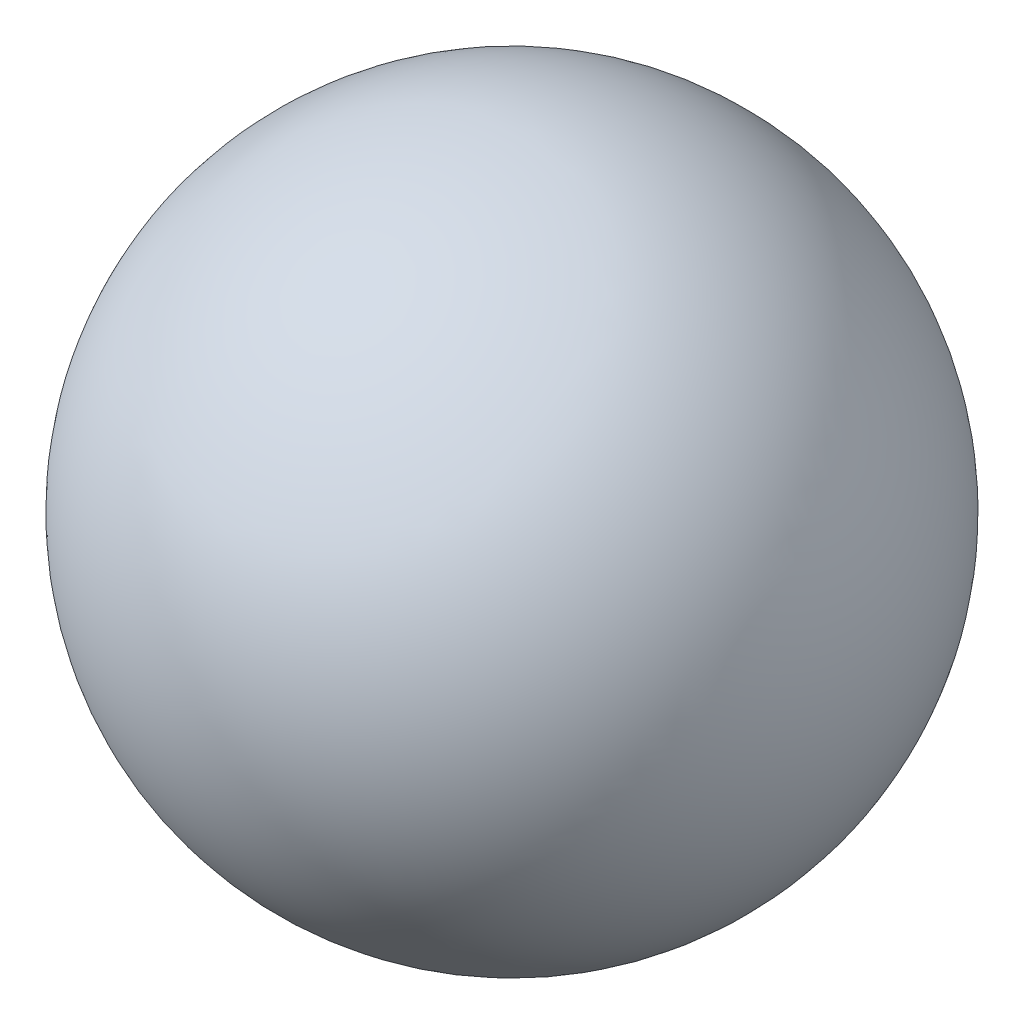
from build123d import *


with BuildPart() as part:
    # Sketch1 → Revolve3 (revolve)
    with BuildSketch(Plane.XY):
        with BuildLine():
            ThreePointArc((0.5, 0), (0, 0.5), (-0.5, 0))
            Line((-0.5, 0), (0.5, 0))
        make_face()
    revolve(axis=Axis((-0.5, 0, 0), (1, 0, 0)))


solid = part.part
